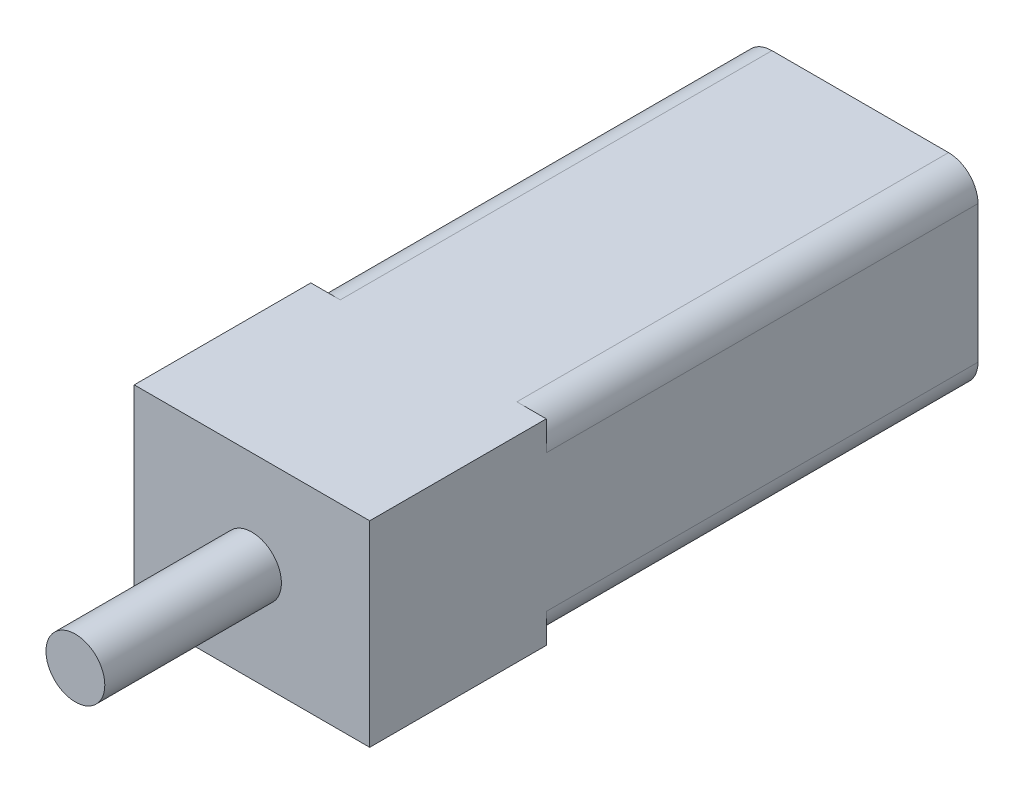
from build123d import *

# Parameters (mm, degrees)
SKETCH1_W           = 12
SKETCH1_H           = 10
BOSS_EXTRUDE2_DEPTH = 9
SKETCH2_R           = 1.5
BOSS_EXTRUDE3_DEPTH = 9
BOSS_EXTRUDE5_DEPTH = 22


with BuildPart() as part:
    # Sketch1 → Boss-Extrude2 (new body)
    with BuildSketch(Plane.XY):
        Rectangle(SKETCH1_W, SKETCH1_H)
    extrude(amount=BOSS_EXTRUDE2_DEPTH)

    # Sketch2 → Boss-Extrude3 (add)
    with BuildSketch(Plane.XY.offset(9)):
        Circle(SKETCH2_R)
    extrude(amount=BOSS_EXTRUDE3_DEPTH)

    # Sketch3 → Boss-Extrude5 (add)
    with BuildSketch(Plane(origin=(0, 0, 0), x_dir=(-1, 0, 0), z_dir=(0, 0, -1))):
        with BuildLine():
            Line((-4.5, 5), (4.5, 5))
            ThreePointArc((4.5, 5), (5.560660172, 4.560660172), (6, 3.5))
            Line((6, 3.5), (6, -3.5))
            ThreePointArc((6, -3.5), (5.560660172, -4.560660172), (4.5, -5))
            Line((4.5, -5), (-4.5, -5))
            ThreePointArc((-4.5, -5), (-5.560660172, -4.560660172), (-6, -3.5))
            Line((-6, -3.5), (-6, 3.5))
            ThreePointArc((-6, 3.5), (-5.560660172, 4.560660172), (-4.5, 5))
        make_face()
    extrude(amount=BOSS_EXTRUDE5_DEPTH)


solid = part.part
